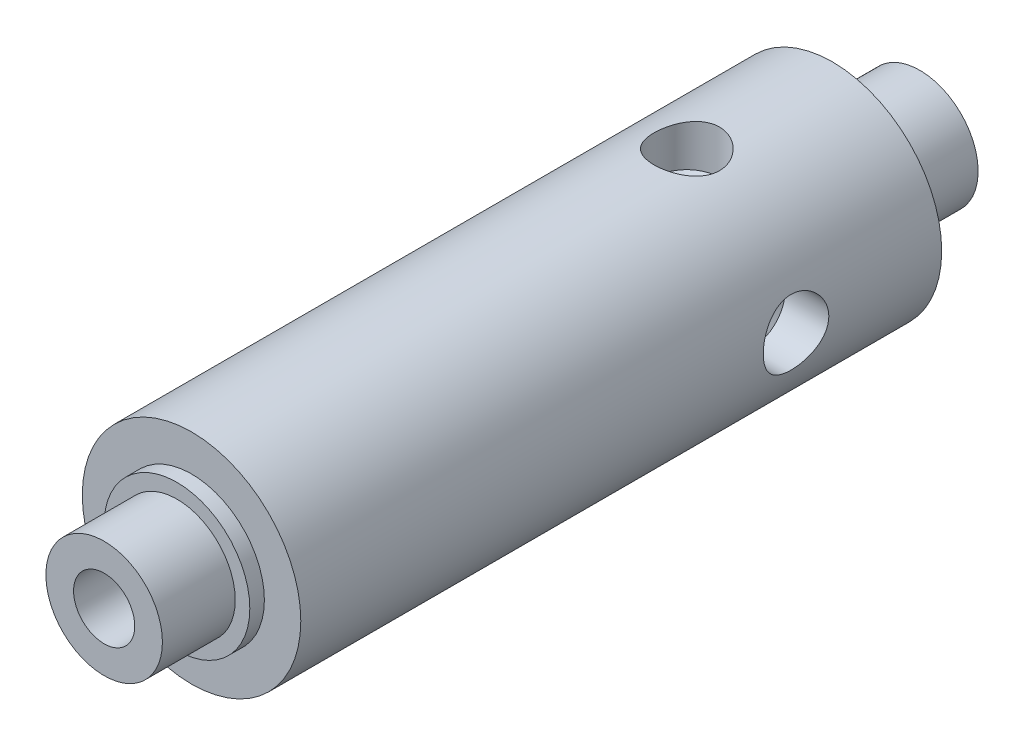
from build123d import *

# Parameters (mm, degrees)
SKETCH_1_R            = 7.5
EXTRUDE_1_DEPTH       = 56
CUT_EXTRUDE_START     = -6
SKETCH_2_R            = 7.5
SKETCH_2_R_2          = 4
CUT_EXTRUDE_1_DEPTH   = 6
SKETCH_3_R            = 7.5
SKETCH_3_R_2          = 4
CUT_EXTRUDE_2_DEPTH   = 6
M5X0_81_D             = 4.2
M5X0_81_DEPTH         = 10
M5X0_81_TIP           = 1.2618073
M5X0_82_D             = 4.2
M5X0_82_DEPTH         = 10
M5X0_82_TIP           = 1.2618073
EXTRUDE_START         = 1
SKETCH_12_R           = 5
SKETCH_12_R_2         = 4
EXTRUDE_2_DEPTH       = 1
SKETCH_13_R           = 5
SKETCH_13_R_2         = 4
EXTRUDE_3_DEPTH       = 1
HOLE_WIZARD_M41_D     = 4.5
HOLE_WIZARD_M41_DEPTH = 3
HOLE_WIZARD_M41_TIP   = 1.351936393
HOLE_WIZARD_M42_D     = 4.5
HOLE_WIZARD_M42_DEPTH = 3
HOLE_WIZARD_M42_TIP   = 1.351936393


with BuildPart() as part:
    # Эскиз1 → Бобышка-Вытянуть1 (new body)
    with BuildSketch(Plane.XY):
        Circle(SKETCH_1_R)
    extrude(amount=EXTRUDE_1_DEPTH)

    # Эскиз2 → Вырез-Вытянуть1 (cut)
    with BuildSketch(Plane.XY.offset(56).offset(CUT_EXTRUDE_START)):
        Circle(SKETCH_2_R)
        Circle(SKETCH_2_R_2, mode=Mode.SUBTRACT)
    extrude(amount=CUT_EXTRUDE_1_DEPTH, mode=Mode.SUBTRACT)

    # Эскиз3 → Вырез-Вытянуть2 (cut)
    with BuildSketch(Plane(origin=(0, 0, 0), x_dir=(-1, 0, 0), z_dir=(0, 0, -1))):
        Circle(SKETCH_3_R)
        Circle(SKETCH_3_R_2, mode=Mode.SUBTRACT)
    extrude(amount=-CUT_EXTRUDE_2_DEPTH, mode=Mode.SUBTRACT)

    # Отверстие обработанное метчиком M5x0.81
    with Locations(Plane(origin=(0, 0, 0), x_dir=(-1, 0, 0), z_dir=(0, 0, -1))):
        with Locations((0, 0)):
            Hole(M5X0_81_D / 2, depth=M5X0_81_DEPTH)
            with Locations((0, 0, -(M5X0_81_DEPTH + M5X0_81_TIP / 2))):  # 118° drill point
                Cone(0, M5X0_81_D / 2, M5X0_81_TIP, mode=Mode.SUBTRACT)

    # Отверстие обработанное метчиком M5x0.82
    with Locations(Plane.XY.offset(56)):
        with Locations((0, 0)):
            Hole(M5X0_82_D / 2, depth=M5X0_82_DEPTH)
            with Locations((0, 0, -(M5X0_82_DEPTH + M5X0_82_TIP / 2))):  # 118° drill point
                Cone(0, M5X0_82_D / 2, M5X0_82_TIP, mode=Mode.SUBTRACT)

    # Эскиз12 → Бобышка-Вытянуть2 (add)
    with BuildSketch(Plane(origin=(0, 0, 6), x_dir=(-1, 0, 0), z_dir=(0, 0, -1)).offset(EXTRUDE_START)):
        Circle(SKETCH_12_R)
        Circle(SKETCH_12_R_2, mode=Mode.SUBTRACT)
    extrude(amount=-EXTRUDE_2_DEPTH)

    # Эскиз13 → Бобышка-Вытянуть3 (add)
    with BuildSketch(Plane.XY.offset(50)):
        Circle(SKETCH_13_R)
        Circle(SKETCH_13_R_2, mode=Mode.SUBTRACT)
    extrude(amount=EXTRUDE_3_DEPTH)

    # Отверстие с зазором M41
    with Locations(Plane(origin=(0, 7.5, 0), x_dir=(1, 0, 0), z_dir=(0, 1, 0))):
        with Locations((0, -16)):
            Hole(HOLE_WIZARD_M41_D / 2, depth=HOLE_WIZARD_M41_DEPTH)
            with Locations((0, 0, -(HOLE_WIZARD_M41_DEPTH + HOLE_WIZARD_M41_TIP / 2))):  # 118° drill point
                Cone(0, HOLE_WIZARD_M41_D / 2, HOLE_WIZARD_M41_TIP, mode=Mode.SUBTRACT)

    # Отверстие с зазором M42
    with Locations(Plane(origin=(7.5, 0, 0), x_dir=(0, 0, -1), z_dir=(1, 0, 0))):
        with Locations((-16, 0)):
            Hole(HOLE_WIZARD_M42_D / 2, depth=HOLE_WIZARD_M42_DEPTH)
            with Locations((0, 0, -(HOLE_WIZARD_M42_DEPTH + HOLE_WIZARD_M42_TIP / 2))):  # 118° drill point
                Cone(0, HOLE_WIZARD_M42_D / 2, HOLE_WIZARD_M42_TIP, mode=Mode.SUBTRACT)


solid = part.part
